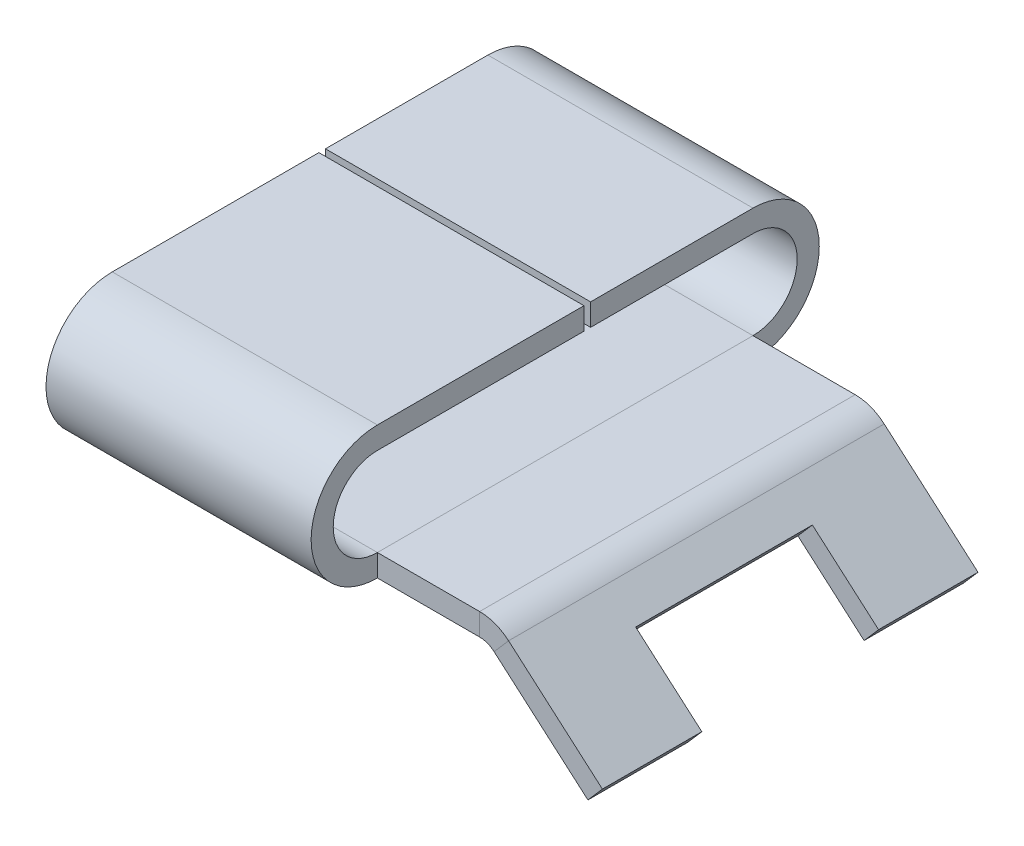
from build123d import *

# Parameters (mm, degrees)
BOSS_EXTRUDE1_DEPTH = 12
BASE_FLANGE1_DEPTH  = 8.5
SKETCH7_W           = 8
SKETCH7_H           = 7.938725448
CUT_EXTRUDE1_DEPTH  = 1


# Sheet-metal steps are written as plain solids
with BuildPart() as part:
    # Sketch1 → Boss-Extrude1 (new body)
    with BuildSketch(Plane(origin=(0, 0, 0), x_dir=(0, 0, -1), z_dir=(1, 0, 0))):
        with BuildLine():
            Line((8.5, -3), (-8.5, -3))
            ThreePointArc((-8.5, -3), (-11.5, 0), (-8.5, 3))
            Line((-8.5, 3), (0.85, 3))
            Line((0.85, 3), (0.85, 2))
            Line((0.85, 2), (-8.5, 2))
            ThreePointArc((-8.5, 2), (-10.5, 0), (-8.5, -2))
            Line((-8.5, -2), (8.5, -2))
            ThreePointArc((8.5, -2), (10.5, 0), (8.5, 2))
            Line((8.5, 2), (1.15, 2))
            Line((1.15, 2), (1.15, 3))
            Line((1.15, 3), (8.5, 3))
            ThreePointArc((8.5, 3), (11.5, 0), (8.5, -3))
        make_face()
    extrude(amount=BOSS_EXTRUDE1_DEPTH)


with BuildPart() as body_2:
    # Sketch2 → Base-Flange1 (new, symmetric)
    with BuildSketch(Plane.XY):
        with BuildLine():
            Line((12, -3), (16.626115321, -3))
            ThreePointArc((16.626115321, -3), (16.976322702, -3.063327811), (17.28217435, -3.24529042))
            Line((17.28217435, -3.24529042), (21.528257481, -6.936354174))
            Line((21.528257481, -6.936354174), (22.18431651, -6.181644594))
            Line((22.18431651, -6.181644594), (17.938233378, -2.49058084))
            ThreePointArc((17.938233378, -2.49058084), (17.326530083, -2.126655622), (16.626115321, -2))
            Line((16.626115321, -2), (12, -2))
            Line((12, -2), (12, -3))
        make_face()
    extrude(amount=BASE_FLANGE1_DEPTH, both=True)

    # Sketch7 → Cut-Extrude1 (cut)
    with BuildSketch(Plane(origin=(6.487685568, 7.463228513, 0), x_dir=(0, 0, -1), z_dir=(0.6560590289905088, 0.7547095802227708, 0))):
        with Locations((0, -20.798239951)):
            Rectangle(SKETCH7_W, SKETCH7_H)
    extrude(amount=-CUT_EXTRUDE1_DEPTH, mode=Mode.SUBTRACT)


solid = Compound([part.part, body_2.part])
